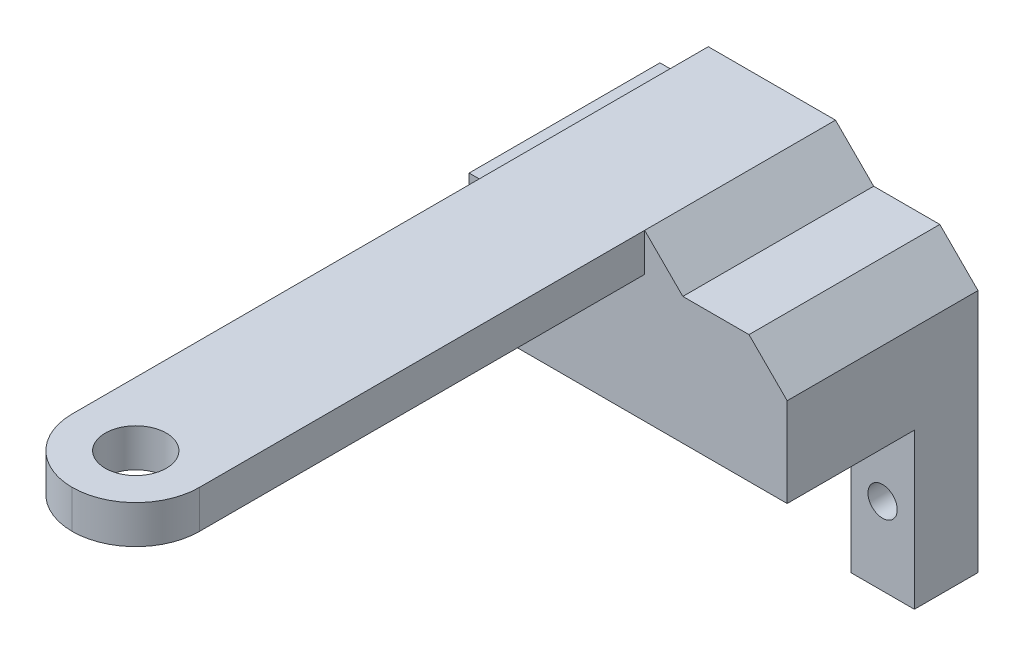
from build123d import *

# Parameters (mm, degrees)
SKETCH1_W                    = 5
SKETCH1_H                    = 5
SERVO_MOUNT_DEPTH            = 12.2
SERVO_MOUNT_SCREW_HOLE_REACH = 22.887
SKETCH2_R                    = 1.15
SKETCH3_W                    = 25
SKETCH3_H                    = 15
SERVO_RETAINING_PLATE_DEPTH  = 10
SKETCH5_W                    = 10
SKETCH5_H                    = 55
NECK_DEPTH                   = 3
NECK_FILLET1_R               = 5
LOWER_SERVO_MOUNT_HOLE_REACH = 64.63
SKETCH6_R                    = 2.4
CHAMFER1_SIZE                = 3


# Some blends are built 0.0001 mm under size
with BuildPart() as part:
    # Sketch1 → servo mount (new body)
    with BuildSketch(Plane(origin=(0, 0, 0), x_dir=(1, 0, 0), z_dir=(0, 1, 0))):
        with Locations((13.7, -2.5)):
            Rectangle(SKETCH1_W, SKETCH1_H)
    extrude(amount=-SERVO_MOUNT_DEPTH)

    # Sketch2 → servo mount screw hole (cut, up to next)
    with BuildSketch(Plane(origin=(0, 0, 0), x_dir=(-1, 0, 0), z_dir=(0, 0, -1)), mode=Mode.PRIVATE) as servo_mount_screw_hole_sk1:
        with Locations((-13.7, -6.1)):
            Circle(SKETCH2_R)
    servo_mount_screw_hole_tool1 = extrude(servo_mount_screw_hole_sk1.sketch, amount=-SERVO_MOUNT_SCREW_HOLE_REACH, mode=Mode.PRIVATE) & part.part
    add(servo_mount_screw_hole_tool1.solids().sort_by_distance((13.7, -6.1, 0))[0], mode=Mode.SUBTRACT)

    # Sketch3 → servo retaining plate (add)
    with BuildSketch(Plane(origin=(0, 0, 0), x_dir=(1, 0, 0), z_dir=(0, 1, 0))):
        with Locations((3.7, -7.5)):
            Rectangle(SKETCH3_W, SKETCH3_H)
    extrude(amount=SERVO_RETAINING_PLATE_DEPTH)

    # Sketch5 → neck (add)
    with BuildSketch(Plane(origin=(0, 10, 0), x_dir=(1, 0, 0), z_dir=(0, 1, 0))):
        with Locations((0, -27.5)):
            Rectangle(SKETCH5_W, SKETCH5_H)
    extrude(amount=NECK_DEPTH)

    # neck fillet1
    neck_fillet1_edges = [part.edges().sort_by_distance(p)[0] for p in [
        (5, 11.5, 55),
        (-5, 11.5, 55),
    ]]
    fillet(neck_fillet1_edges, radius=NECK_FILLET1_R - 0.0001)  # a hair under: the kernel refuses the full size

    # Sketch6 → lower servo mount hole (cut, up to next)
    with BuildSketch(Plane(origin=(0, 13, 0), x_dir=(1, 0, 0), z_dir=(0, 1, 0)), mode=Mode.PRIVATE) as lower_servo_mount_hole_sk1:
        with Locations(Location((0, -50, 0), (0, 0, 270))):
            Circle(SKETCH6_R)
    lower_servo_mount_hole_tool1 = extrude(lower_servo_mount_hole_sk1.sketch, amount=-LOWER_SERVO_MOUNT_HOLE_REACH, mode=Mode.PRIVATE) & part.part
    add(lower_servo_mount_hole_tool1.solids().sort_by_distance((0, 13, 50))[0], mode=Mode.SUBTRACT)

    # Chamfer1
    # the kernel refuses this chamfer: 3 mm, written as the material it adds along each edge
    with BuildSketch(Plane(origin=(-5, 10, 15), x_dir=(0.027495876610586494, 0.9996219169112968, 0), z_dir=(0, 0, -1)), Plane(origin=(5, 10, 0), x_dir=(-0.027495876610586494, 0.9996219169112968, 0), z_dir=(0, 0, 1))) as chamfer1_piece_1:
        Polygon((CHAMFER1_SIZE * 0.999621916911, -CHAMFER1_SIZE * 0.0274958766106), (-CHAMFER1_SIZE * 0.0274958766106, -CHAMFER1_SIZE * 0.999621916911), (0, 0), align=None)
    extrude(amount=15)
    # the kernel refuses this chamfer: 3 mm, written as the material it takes off along each edge
    with BuildSketch(Plane(origin=(16.2, 10, 22.715048964), x_dir=(0.027495876610586775, -0.9996219169112968, 0), z_dir=(0, 0, -1))) as chamfer1_2_piece_1:
        Polygon((CHAMFER1_SIZE * 0.999621916911, CHAMFER1_SIZE * 0.0274958766106), (-CHAMFER1_SIZE * 0.0274958766106, CHAMFER1_SIZE * 0.999621916911), (0, 0), align=None)
    extrude(amount=30.430097928, mode=Mode.SUBTRACT)


solid = part.part
